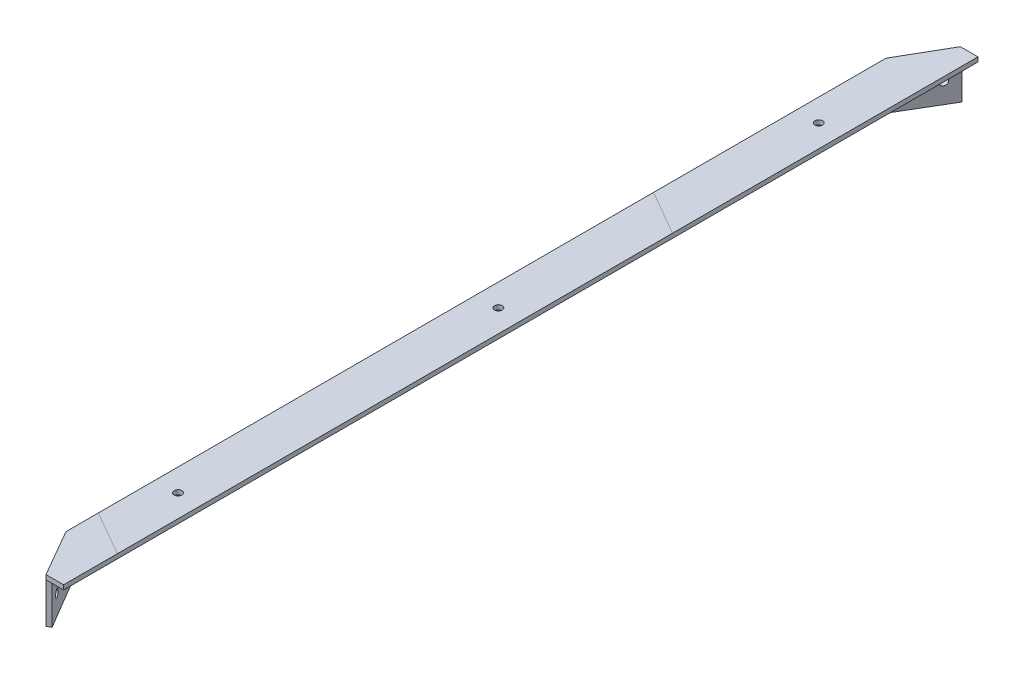
from build123d import *
from build123d.topology import SkipClean

# Parameters (mm, degrees)
BOSS_EXTRUDE1_DEPTH = 640
SKETCH22_R          = 6
CUT_EXTRUDE4_DEPTH  = 10
BOSS_EXTRUDE2_DEPTH = 63
BOSS_EXTRUDE3_DEPTH = 7
SKETCH26_R          = 6
CUT_EXTRUDE5_DEPTH  = 7
FILLET1_R           = 10
FILLET2_R           = 10
FILLET3_R           = 5


with BuildPart() as part:
    # Sketch1 → Boss-Extrude1 (new body)
    with BuildSketch(Plane.XY):
        Polygon((0, 0), (0, 70), (70, 70), (70, 63), (7, 63), (7, 0), align=None)
    extrude(amount=BOSS_EXTRUDE1_DEPTH)

    # Sketch22 → Cut-Extrude4 (cut)
    with BuildSketch(Plane(origin=(0, 70, 0), x_dir=(1, 0, 0), z_dir=(0, 1, 0))):
        with Locations((35, 0)):
            Circle(SKETCH22_R)
        with Locations((35, 500)):
            Circle(SKETCH22_R)
        with Locations((35, -500)):
            Circle(SKETCH22_R)
    extrude(amount=-CUT_EXTRUDE4_DEPTH, mode=Mode.SUBTRACT)

    # Sketch23 → Boss-Extrude2 (add)
    with BuildSketch(Plane(origin=(0, 0, 0), x_dir=(1, 0, 0), z_dir=(0, 1, 0))):
        Polygon((0, -640), (42.5, -713.612159322), (48.562177826, -710.112159322), (7, -640), align=None)
    extrude(amount=BOSS_EXTRUDE2_DEPTH)

    # Sketch25 → Boss-Extrude3 (add)
    with BuildSketch(Plane(origin=(0, 63, 0), x_dir=(1, 0, 0), z_dir=(0, 1, 0))):
        Polygon((70, -640), (0, -640), (42.5, -713.612159322), (70, -713.612159322), align=None)
    extrude(amount=BOSS_EXTRUDE3_DEPTH)

    # Sketch26 → Cut-Extrude5 (cut)
    with BuildSketch(Plane(origin=(-275.556719825, 0, 163.348804279), x_dir=(-0.5099316128113042, 0, -0.8602149442178172), z_dir=(0.8602149442178172, 0, -0.5099316128113042))):
        with Locations((-614.36248118, 31.5)):
            Circle(SKETCH26_R)
        with Locations((-575.367085589, 31.5)):
            Circle(SKETCH26_R)
    extrude(amount=-CUT_EXTRUDE5_DEPTH, mode=Mode.SUBTRACT)

    # Mirror1: part across plane


with BuildPart() as part_1:
    with SkipClean():  # the faces are left unmerged after this step: merging them gives an invalid solid
        add(part.part)
        add(part.part.mirror(Plane.XY))

    # Fillet1
    fillet1_edges = [part_1.edges().sort_by_distance(p)[0] for p in [
        (0, 35, -640),
        (0, 35, 640),
    ]]
    fillet(fillet1_edges, radius=FILLET1_R)

    # Fillet2
    fillet2_edges = [part_1.edges().sort_by_distance(p)[0] for p in [
        (7, 31.5, 640),
        (7, 31.5, -640),
    ]]
    fillet(fillet2_edges, radius=FILLET2_R)

    # Fillet3
    fillet3_edges = [part_1.edges().sort_by_distance(p)[0] for p in [
        (28.480014192, 63, 676.235112211),
        (7.355792038, 63, 639.902468471),
        (28.480014192, 63, -676.235112211),
        (7.355792038, 63, -639.902468471),
        (7, 63, 318.629374486),
    ]]
    fillet(fillet3_edges, radius=FILLET3_R)


solid = part_1.part
